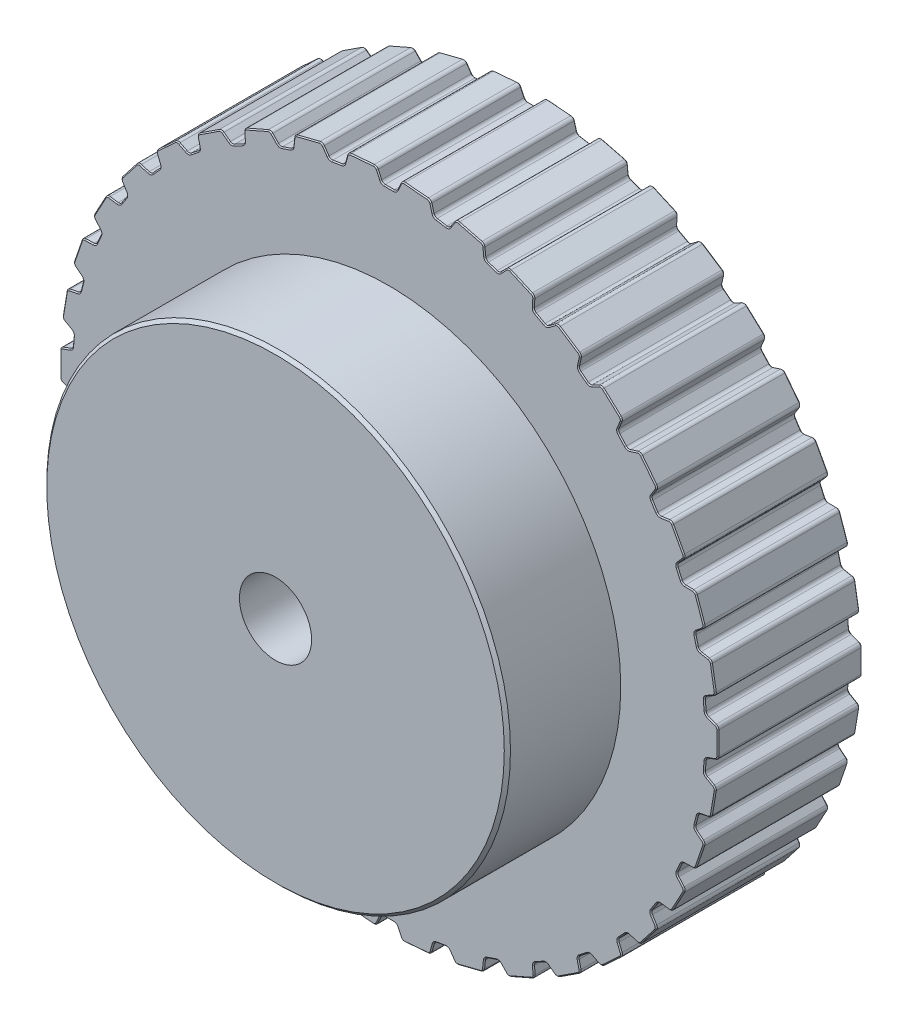
from build123d import *

# Parameters (mm, degrees)
SKETCH1_R           = 32
BOSS_EXTRUDE1_DEPTH = 14
SKETCH2_R           = 22.5
SKETCH2_R_2         = 3.5
BOSS_EXTRUDE2_DEPTH = 11
SKETCH2_2_R         = 3.5
CUT_EXTRUDE1_DEPTH  = 48.370877129
SKETCH3_OUTSIDE_W   = 84.78
SKETCH3_OUTSIDE_H   = 84.78
CUT_EXTRUDE2_DEPTH  = 48.370877129
CHAMFER1_SIZE       = 0.1
CHAMFER2_SIZE       = 0.3


with BuildPart() as part:
    # Sketch1 → Boss-Extrude1 (new body)
    with BuildSketch(Plane.XY):
        Circle(SKETCH1_R)
    extrude(amount=BOSS_EXTRUDE1_DEPTH)

    # Sketch2 → Boss-Extrude2 (add)
    with BuildSketch(Plane.XY.offset(14)):
        Circle(SKETCH2_R)
        Circle(SKETCH2_R_2, mode=Mode.SUBTRACT)
    extrude(amount=BOSS_EXTRUDE2_DEPTH)

    # Sketch2<2> → Cut-Extrude1 (cut, through all)
    with BuildSketch(Plane.XY.offset(14)):
        Circle(SKETCH2_2_R)
    extrude(amount=-CUT_EXTRUDE1_DEPTH, mode=Mode.SUBTRACT)

    # Sketch3 outside → Cut-Extrude2 (cut, through all)
    with BuildSketch(Plane.XY.offset(14)):
        Rectangle(SKETCH3_OUTSIDE_W, SKETCH3_OUTSIDE_H)
        with BuildLine():
            Line((0.450702575, 30.73), (-0.450702575, 30.73))
            ThreePointArc((-0.450702575, 30.73), (-0.654876426, 30.789511251), (-0.795099534, 30.949405061))
            Line((-0.795099534, 30.949405061), (-1.127200423, 31.661597716))
            ThreePointArc((-1.127200423, 31.661597716), (-1.280803372, 31.829709395), (-1.502939845, 31.879817176))
            Line((-1.502939845, 31.879817176), (-3.74156592, 31.694835267))
            ThreePointArc((-3.74156592, 31.694835267), (-3.952464615, 31.608944972), (-4.07638982, 31.417900616))
            Line((-4.07638982, 31.417900616), (-4.286167994, 30.663258392))
            ThreePointArc((-4.286167994, 30.663258392), (-4.398188573, 30.482482452), (-4.589796613, 30.390206185))
            Line((-4.589796613, 30.390206185), (-5.536262381, 30.232417433))
            ThreePointArc((-5.536262381, 30.232417433), (-5.747442965, 30.257543343), (-5.912050721, 30.392201566))
            Line((-5.912050721, 30.392201566), (-6.355297393, 31.037975642))
            ThreePointArc((-6.355297393, 31.037975642), (-6.534497114, 31.178484938), (-6.761853365, 31.191312157))
            Line((-6.761853365, 31.191312157), (-8.939416379, 30.640055112))
            ThreePointArc((-8.939416379, 30.640055112), (-9.133283385, 30.520593878), (-9.224041675, 30.311743847))
            Line((-9.224041675, 30.311743847), (-9.306899845, 29.530306772))
            ThreePointArc((-9.306899845, 29.530306772), (-9.387607843, 29.333546081), (-9.56139572, 29.210964173))
            Line((-9.56139572, 29.210964173), (-10.413960253, 28.918278399))
            ThreePointArc((-10.413960253, 28.918278399), (-10.626394673, 28.908270025), (-10.810937541, 29.013969979))
            Line((-10.810937541, 29.013969979), (-11.356292865, 29.579741089))
            ThreePointArc((-11.356292865, 29.579741089), (-11.556158955, 29.688869218), (-11.782529432, 29.664134426))
            Line((-11.782529432, 29.664134426), (-13.839797043, 28.762294649))
            ThreePointArc((-13.839797043, 28.762294649), (-14.011380132, 28.612579432), (-14.066558727, 28.391647938))
            Line((-14.066558727, 28.391647938), (-14.019938611, 27.60977945))
            ThreePointArc((-14.019938611, 27.60977945), (-14.067191755, 27.402425427), (-14.218455888, 27.252933913))
            Line((-14.218455888, 27.252933913), (-15.062405605, 26.796377658))
            ThreePointArc((-15.062405605, 26.796377658), (-15.270302212, 26.751571954), (-15.46971452, 26.825485971))
            Line((-15.46971452, 26.825485971), (-16.098627364, 27.292348268))
            ThreePointArc((-16.098627364, 27.292348268), (-16.313740844, 27.367058329), (-16.532943297, 27.305368079))
            Line((-16.532943297, 27.305368079), (-18.413527071, 26.076926107))
            ThreePointArc((-18.413527071, 26.076926107), (-18.558100828, 25.900989098), (-18.57612809, 25.67398597))
            Line((-18.57612809, 25.67398597), (-18.400764572, 24.907985307))
            ThreePointArc((-18.400764572, 24.907985307), (-18.413211496, 24.695679809), (-18.537780786, 24.523310895))
            Line((-18.537780786, 24.523310895), (-19.249116105, 23.969656393))
            ThreePointArc((-19.249116105, 23.969656393), (-19.446790529, 23.891212956), (-19.655655074, 23.931264823))
            Line((-19.655655074, 23.931264823), (-20.355167122, 24.28930431))
            ThreePointArc((-20.355167122, 24.28930431), (-20.579637762, 24.327623163), (-20.785711487, 24.230726196))
            Line((-20.785711487, 24.230726196), (-22.438683768, 22.709756885))
            ThreePointArc((-22.438683768, 22.709756885), (-22.55235756, 22.512440714), (-22.532810088, 22.285563437))
            Line((-22.532810088, 22.285563437), (-22.234843695, 21.561196266))
            ThreePointArc((-22.234843695, 21.561196266), (-22.212208793, 21.349734185), (-22.306737202, 21.159227151))
            Line((-22.306737202, 21.159227151), (-22.956715823, 20.453378348))
            ThreePointArc((-22.956715823, 20.453378348), (-23.13879963, 20.343496422), (-23.351407071, 20.348656504))
            Line((-23.351407071, 20.348656504), (-24.097833622, 20.586015247))
            ThreePointArc((-24.097833622, 20.586015247), (-24.325549977, 20.586830078), (-24.512844646, 20.457307456))
            Line((-24.512844646, 20.457307456), (-25.892658747, 18.684801305))
            ThreePointArc((-25.892658747, 18.684801305), (-25.972272446, 18.471454026), (-25.915615145, 18.250897111))
            Line((-25.915615145, 18.250897111), (-25.501033298, 17.583340918))
            ThreePointArc((-25.501033298, 17.583340918), (-25.443870331, 17.378497208), (-25.505722019, 17.175020135))
            Line((-25.505722019, 17.175020135), (-25.998743905, 16.42039396))
            ThreePointArc((-25.998743905, 16.42039396), (-26.160237241, 16.282016025), (-26.370789749, 16.252079565))
            Line((-26.370789749, 16.252079565), (-27.148655536, 16.363588294))
            ThreePointArc((-27.148655536, 16.363588294), (-27.373405849, 16.326945428), (-27.536851537, 16.168386577))
            Line((-27.536851537, 16.168386577), (-28.606403293, 14.193108356))
            ThreePointArc((-28.606403293, 14.193108356), (-28.649849469, 13.969573499), (-28.557694202, 13.761336113))
            Line((-28.557694202, 13.761336113), (-28.040670814, 13.172966683))
            ThreePointArc((-28.040670814, 13.172966683), (-27.950600707, 12.980311742), (-27.978149774, 12.76943358))
            Line((-27.978149774, 12.76943358), (-28.363722028, 11.890781899))
            ThreePointArc((-28.363722028, 11.890781899), (-28.50026143, 11.727731163), (-28.703024689, 11.663578134))
            Line((-28.703024689, 11.663578134), (-29.486078048, 11.645711821))
            ThreePointArc((-29.486078048, 11.645711821), (-29.701720679, 11.572543122), (-29.836811279, 11.389223914))
            Line((-29.836811279, 11.389223914), (-30.56633144, 9.264732129))
            ThreePointArc((-30.56633144, 9.264732129), (-30.572357701, 9.037094069), (-30.447155536, 8.846884131))
            Line((-30.447155536, 8.846884131), (-29.838281735, 8.35011248))
            ThreePointArc((-29.838281735, 8.35011248), (-29.717703371, 8.174928552), (-29.710134866, 7.962393218))
            Line((-29.710134866, 7.962393218), (-29.931416749, 7.088570826))
            ThreePointArc((-29.931416749, 7.088570826), (-30.039228688, 6.905253788), (-30.228652528, 6.80857308))
            Line((-30.228652528, 6.80857308), (-31.000578226, 6.661467351))
            ThreePointArc((-31.000578226, 6.661467351), (-31.201253027, 6.553833589), (-31.304358803, 6.350795166))
            Line((-31.304358803, 6.350795166), (-31.674587505, 4.13526008))
            ThreePointArc((-31.674587505, 4.13526008), (-31.643097998, 3.909730008), (-31.488321388, 3.742698264))
            Line((-31.488321388, 3.742698264), (-30.808268512, 3.354085532))
            ThreePointArc((-30.808268512, 3.354085532), (-30.660523695, 3.201114883), (-30.61810805, 2.992717514))
            Line((-30.61810805, 2.992717514), (-30.697491202, 2.036478498))
            ThreePointArc((-30.697491202, 2.036478498), (-30.773690034, 1.83792803), (-30.944636567, 1.711413867))
            Line((-30.944636567, 1.711413867), (-31.679460753, 1.44025859))
            ThreePointArc((-31.679460753, 1.44025859), (-31.859661433, 1.301035325), (-31.927908802, 1.083785011))
            Line((-31.927908802, 1.083785011), (-31.928080194, -1.162470758))
            ThreePointArc((-31.928080194, -1.162470758), (-31.859865978, -1.379731484), (-31.679686546, -1.518982246))
            Line((-31.679686546, -1.518982246), (-30.942501715, -1.791136439))
            ThreePointArc((-30.942501715, -1.791136439), (-30.771574491, -1.917676688), (-30.695405959, -2.116238782))
            Line((-30.695405959, -2.116238782), (-30.620968511, -3.014565176))
            ThreePointArc((-30.620968511, -3.014565176), (-30.663415958, -3.22295607), (-30.811184117, -3.375904171))
            Line((-30.811184117, -3.375904171), (-31.493519599, -3.765683171))
            ThreePointArc((-31.493519599, -3.765683171), (-31.648372661, -3.93264404), (-31.679965413, -4.158159672))
            Line((-31.679965413, -4.158159672), (-31.310751036, -6.373864019))
            ThreePointArc((-31.310751036, -6.373864019), (-31.207738223, -6.576949624), (-31.007112718, -6.684675244))
            Line((-31.007112718, -6.684675244), (-30.237724636, -6.831419058))
            ThreePointArc((-30.237724636, -6.831419058), (-30.048315552, -6.928128672), (-29.940531588, -7.111462159))
            Line((-29.940531588, -7.111462159), (-29.705123241, -8.041665174))
            ThreePointArc((-29.705123241, -8.041665174), (-29.712724179, -8.254199351), (-29.833329275, -8.429364876))
            Line((-29.833329275, -8.429364876), (-30.440294685, -8.924425236))
            ThreePointArc((-30.440294685, -8.924425236), (-30.565525875, -9.114616065), (-30.559534352, -9.342255043))
            Line((-30.559534352, -9.342255043), (-29.830338401, -11.466858129))
            ThreePointArc((-29.830338401, -11.466858129), (-29.695275777, -11.65019795), (-29.479644315, -11.723399556))
            Line((-29.479644315, -11.723399556), (-28.69403387, -11.741444161))
            ThreePointArc((-28.69403387, -11.741444161), (-28.491280403, -11.805628131), (-28.354765885, -11.9686997))
            Line((-28.354765885, -11.9686997), (-27.992675561, -12.794182493))
            ThreePointArc((-27.992675561, -12.794182493), (-27.965158675, -13.005064857), (-28.05525818, -13.197706051))
            Line((-28.05525818, -13.197706051), (-28.574061809, -13.787919719))
            ThreePointArc((-28.574061809, -13.787919719), (-28.6663124, -13.996114894), (-28.622968564, -14.219669617))
            Line((-28.622968564, -14.219669617), (-27.554321214, -16.195437278))
            ThreePointArc((-27.554321214, -16.195437278), (-27.390948132, -16.354070939), (-27.166214618, -16.390816693))
            Line((-27.166214618, -16.390816693), (-26.390866466, -16.279789621))
            ThreePointArc((-26.390866466, -16.279789621), (-26.180318528, -16.309758212), (-26.018846311, -16.448160789))
            Line((-26.018846311, -16.448160789), (-25.494156612, -17.251525874))
            ThreePointArc((-25.494156612, -17.251525874), (-25.432335976, -17.455012383), (-25.489530202, -17.659847368))
            Line((-25.489530202, -17.659847368), (-25.902862716, -18.325165338))
            ThreePointArc((-25.902862716, -18.325165338), (-25.959553673, -18.545713605), (-25.879972532, -18.75907303))
            Line((-25.879972532, -18.75907303), (-24.500428935, -20.531789723))
            ThreePointArc((-24.500428935, -20.531789723), (-24.313154034, -20.661340925), (-24.085437557, -20.660560844))
            Line((-24.085437557, -20.660560844), (-23.336534579, -20.422540448))
            ThreePointArc((-23.336534579, -20.422540448), (-23.123926353, -20.41741281), (-22.941859316, -20.527322521))
            Line((-22.941859316, -20.527322521), (-22.331354219, -21.190507843))
            ThreePointArc((-22.331354219, -21.190507843), (-22.236854883, -21.381029301), (-22.259522055, -21.592487925))
            Line((-22.259522055, -21.592487925), (-22.558573408, -22.319177451))
            ThreePointArc((-22.558573408, -22.319177451), (-22.578224744, -22.546045755), (-22.464641297, -22.743413946))
            Line((-22.464641297, -22.743413946), (-20.812365498, -24.265139839))
            ThreePointArc((-20.812365498, -24.265139839), (-20.606336154, -24.362131137), (-20.381847995, -24.323915052))
            Line((-20.381847995, -24.323915052), (-19.684560775, -23.967148599))
            ThreePointArc((-19.684560775, -23.967148599), (-19.47569012, -23.927128606), (-19.27802767, -24.005602207))
            Line((-19.27802767, -24.005602207), (-18.520914889, -24.595072288))
            ThreePointArc((-18.520914889, -24.595072288), (-18.396371904, -24.76746021), (-18.383957379, -24.979767605))
            Line((-18.383957379, -24.979767605), (-18.558866005, -25.74324566))
            ThreePointArc((-18.558866005, -25.74324566), (-18.540873385, -25.970251537), (-18.396326477, -26.146210606))
            Line((-18.396326477, -26.146210606), (-16.515930189, -27.374939545))
            ThreePointArc((-16.515930189, -27.374939545), (-16.296737152, -27.436663244), (-16.081612273, -27.361986011))
            Line((-16.081612273, -27.361986011), (-15.450572021, -26.893693817))
            ThreePointArc((-15.450572021, -26.893693817), (-15.251148436, -26.819810231), (-15.043258669, -26.86464766))
            Line((-15.043258669, -26.86464766), (-14.2504965, -27.293669092))
            ThreePointArc((-14.2504965, -27.293669092), (-14.099255182, -27.443183687), (-14.052033681, -27.650544918))
            Line((-14.052033681, -27.650544918), (-14.098925904, -28.434962217))
            ThreePointArc((-14.098925904, -28.434962217), (-14.043848458, -28.655918949), (-13.872333928, -28.805712702))
            Line((-13.872333928, -28.805712702), (-11.8154794, -29.708494213))
            ThreePointArc((-11.8154794, -29.708494213), (-11.589120271, -29.733332637), (-11.389204243, -29.624296019))
            Line((-11.389204243, -29.624296019), (-10.845539846, -29.060451366))
            ThreePointArc((-10.845539846, -29.060451366), (-10.66098085, -28.954779575), (-10.448547959, -28.964820368))
            Line((-10.448547959, -28.964820368), (-9.541057015, -29.276517216))
            ThreePointArc((-9.541057015, -29.276517216), (-9.367287846, -29.399125643), (-9.286609875, -29.595898648))
            Line((-9.286609875, -29.595898648), (-9.20414055, -30.374802095))
            ThreePointArc((-9.20414055, -30.374802095), (-9.113414132, -30.583665973), (-8.919565358, -30.70315679))
            Line((-8.919565358, -30.70315679), (-6.742086493, -31.254746129))
            ThreePointArc((-6.742086493, -31.254746129), (-6.514728287, -31.241953605), (-6.335507126, -31.101471657))
            Line((-6.335507126, -31.101471657), (-5.890712601, -30.453654391))
            ThreePointArc((-5.890712601, -30.453654391), (-5.726084298, -30.319021289), (-5.514899882, -30.293927606))
            Line((-5.514899882, -30.293927606), (-4.625788723, -30.442294017))
            ThreePointArc((-4.625788723, -30.442294017), (-4.434194767, -30.534599523), (-4.322201776, -30.715392555))
            Line((-4.322201776, -30.715392555), (-4.111853368, -31.472533841))
            ThreePointArc((-4.111853368, -31.472533841), (-3.988015637, -31.66363491), (-3.777156285, -31.749621747))
            Line((-3.777156285, -31.749621747), (-1.538615131, -31.935628493))
            ThreePointArc((-1.538615131, -31.935628493), (-1.316455741, -31.885622413), (-1.162775847, -31.717581072))
            Line((-1.162775847, -31.717581072), (-0.831648746, -31.007759536))
            ThreePointArc((-0.831648746, -31.007759536), (-0.691401239, -30.847887127), (-0.487218309, -30.788407034))
            Line((-0.487218309, -30.788407034), (0.472310074, -30.78855346))
            ThreePointArc((0.472310074, -30.78855346), (0.676474842, -30.848095867), (0.816673548, -31.008011074))
            Line((0.816673548, -31.008011074), (1.147583993, -31.717933637))
            ThreePointArc((1.147583993, -31.717933637), (1.301212593, -31.886021874), (1.523356711, -31.936095756))
            Line((1.523356711, -31.936095756), (3.761954531, -31.750772231))
            ThreePointArc((3.761954531, -31.750772231), (3.972840116, -31.664849753), (4.096736166, -31.473786488))
            Line((4.096736166, -31.473786488), (4.307084574, -30.716645202))
            ThreePointArc((4.307084574, -30.716645202), (4.419077565, -30.53585217), (4.610671522, -30.443546664))
            Line((4.610671522, -30.443546664), (5.49978268, -30.295180253))
            ThreePointArc((5.49978268, -30.295180253), (5.710967096, -30.320273936), (5.8755954, -30.454907038))
            Line((5.8755954, -30.454907038), (6.320389924, -31.102724304))
            ThreePointArc((6.320389924, -31.102724304), (6.499568201, -31.243260945), (6.726922492, -31.256122858))
            Line((6.726922492, -31.256122858), (8.904569604, -30.705198121))
            ThreePointArc((8.904569604, -30.705198121), (9.098454837, -30.585766472), (9.189244997, -30.376930294))
            Line((9.189244997, -30.376930294), (9.271952042, -29.598052054))
            ThreePointArc((9.271952042, -29.598052054), (9.352690065, -29.401303681), (9.526496647, -29.278748295))
            Line((9.526496647, -29.278748295), (10.43408268, -28.96732843))
            ThreePointArc((10.43408268, -28.96732843), (10.646518625, -28.957352474), (10.831045361, -29.063080588))
            Line((10.831045361, -29.063080588), (11.374537645, -29.627091143))
            ThreePointArc((11.374537645, -29.627091143), (11.574420386, -29.736188771), (11.800787085, -29.711419434))
            Line((11.800787085, -29.711419434), (13.85791705, -28.809265725))
            ThreePointArc((13.85791705, -28.809265725), (14.02947729, -28.659524326), (14.08462217, -28.438584414))
            Line((14.08462217, -28.438584414), (14.037729947, -27.654167116))
            ThreePointArc((14.037729947, -27.654167116), (14.084951448, -27.446805884), (14.236192766, -27.297291289))
            Line((14.236192766, -27.297291289), (15.028954935, -26.868269858))
            ThreePointArc((15.028954935, -26.868269858), (15.236844702, -26.823432428), (15.436268287, -26.897316015))
            Line((15.436268287, -26.897316015), (16.067308539, -27.365608208))
            ThreePointArc((16.067308539, -27.365608208), (16.282410616, -27.440351095), (16.501622481, -27.378694297))
            Line((16.501622481, -27.378694297), (18.382393695, -26.15053932))
            ThreePointArc((18.382393695, -26.15053932), (18.526994299, -25.974624375), (18.545056201, -25.747624001))
            Line((18.545056201, -25.747624001), (18.3703806, -24.984092598))
            ThreePointArc((18.3703806, -24.984092598), (18.382859922, -24.771789002), (18.507455515, -24.5994391))
            Line((18.507455515, -24.5994391), (19.264748168, -24.010200119))
            ThreePointArc((19.264748168, -24.010200119), (19.46243456, -23.931786849), (19.671292991, -23.971870589))
            Line((19.671292991, -23.971870589), (20.368471292, -24.32884984))
            ThreePointArc((20.368471292, -24.32884984), (20.592947776, -24.367134438), (20.799006713, -24.270206025))
            Line((20.799006713, -24.270206025), (22.451746872, -22.748984485))
            ThreePointArc((22.451746872, -22.748984485), (22.565390552, -22.551650969), (22.545808458, -22.324776677))
            Line((22.545808458, -22.324776677), (22.246757104, -21.598087152))
            ThreePointArc((22.246757104, -21.598087152), (22.224089932, -21.386628527), (22.318589269, -21.19610707))
            Line((22.318589269, -21.19610707), (22.929094366, -20.532921748))
            ThreePointArc((22.929094366, -20.532921748), (23.111161402, -20.423012037), (23.323769628, -20.428139674))
            Line((23.323769628, -20.428139674), (24.072672606, -20.66616007))
            ThreePointArc((24.072672606, -20.66616007), (24.300388835, -20.667009651), (24.487703267, -20.537515612))
            Line((24.487703267, -20.537515612), (25.86778784, -18.765220045))
            ThreePointArc((25.86778784, -18.765220045), (25.947434095, -18.551884917), (25.890810452, -18.331319359))
            Line((25.890810452, -18.331319359), (25.477681015, -17.665875269))
            ThreePointArc((25.477681015, -17.665875269), (25.420549308, -17.461022838), (25.482432046, -17.257555206))
            Line((25.482432046, -17.257555206), (26.007366911, -16.454350296))
            ThreePointArc((26.007366911, -16.454350296), (26.168881362, -16.315997007), (26.379438436, -16.286092677))
            Line((26.379438436, -16.286092677), (27.154752667, -16.397356384))
            ThreePointArc((27.154752667, -16.397356384), (27.379497385, -16.360679221), (27.542918876, -16.20209543))
            Line((27.542918876, -16.20209543), (28.612169187, -14.226654016))
            ThreePointArc((28.612169187, -14.226654016), (28.655581251, -14.003112532), (28.563394207, -13.794889211))
            Line((28.563394207, -13.794889211), (28.044590578, -13.204675544))
            ThreePointArc((28.044590578, -13.204675544), (27.954491072, -13.01203435), (27.982007958, -12.801151986))
            Line((27.982007958, -12.801151986), (28.344098283, -11.975669193))
            ThreePointArc((28.344098283, -11.975669193), (28.480612801, -11.812597623), (28.683366268, -11.748413653))
            Line((28.683366268, -11.748413653), (29.468976713, -11.730369048))
            ThreePointArc((29.468976713, -11.730369048), (29.684630506, -11.657233258), (29.81974908, -11.473934666))
            Line((29.81974908, -11.473934666), (30.549593434, -9.349554233))
            ThreePointArc((30.549593434, -9.349554233), (30.555654433, -9.121917094), (30.430481296, -8.931688053))
            Line((30.430481296, -8.931688053), (29.823667008, -8.436442468))
            ThreePointArc((29.823667008, -8.436442468), (29.703115379, -8.261240142), (29.695579308, -8.048703655))
            Line((29.695579308, -8.048703655), (29.931271546, -7.118572531))
            ThreePointArc((29.931271546, -7.118572531), (30.039111458, -6.935271948), (30.22855005, -6.838620147))
            Line((30.22855005, -6.838620147), (30.997982883, -6.69211116))
            ThreePointArc((30.997982883, -6.69211116), (31.198641257, -6.584446777), (31.301716048, -6.381392621))
            Line((31.301716048, -6.381392621), (31.67160665, -4.165801064))
            ThreePointArc((31.67160665, -4.165801064), (31.640082727, -3.9402758), (31.48528063, -3.773267677))
            Line((31.48528063, -3.773267677), (30.802945147, -3.383488677))
            ThreePointArc((30.802945147, -3.383488677), (30.655176988, -3.230540576), (30.612729542, -3.022149682))
            Line((30.612729542, -3.022149682), (30.687166989, -2.123823287))
            ThreePointArc((30.687166989, -2.123823287), (30.763335522, -1.925261194), (30.934262746, -1.798720945))
            Line((30.934262746, -1.798720945), (31.671447576, -1.526566752))
            ThreePointArc((31.671447576, -1.526566752), (31.8516695, -1.387370988), (31.919950021, -1.170131091))
            Line((31.919950021, -1.170131091), (31.920464196, 1.076124625))
            ThreePointArc((31.920464196, 1.076124625), (31.852283135, 1.293395759), (31.672124955, 1.432674015))
            Line((31.672124955, 1.432674015), (30.937383561, 1.704053551))
            ThreePointArc((30.937383561, 1.704053551), (30.766475649, 1.830619882), (30.690337419, 2.029193597))
            Line((30.690337419, 2.029193597), (30.611246119, 2.985456796))
            ThreePointArc((30.611246119, 2.985456796), (30.653725365, 3.19384121), (30.801516863, 3.34676676))
            Line((30.801516863, 3.34676676), (31.481688313, 3.735171919))
            ThreePointArc((31.481688313, 3.735171919), (31.636515895, 3.902156416), (31.668074232, 4.127676867))
            Line((31.668074232, 4.127676867), (31.298521738, 6.343324845))
            ThreePointArc((31.298521738, 6.343324845), (31.195477935, 6.546394727), (30.994835994, 6.65408973))
            Line((30.994835994, 6.65408973), (30.222910295, 6.80119546))
            ThreePointArc((30.222910295, 6.80119546), (30.033486456, 6.897876168), (29.925674516, 7.081193205))
            Line((29.925674516, 7.081193205), (29.704392634, 7.955015598))
            ThreePointArc((29.704392634, 7.955015598), (29.711961139, 8.167550932), (29.832539503, 8.34273486))
            Line((29.832539503, 8.34273486), (30.441413304, 8.839506511))
            ThreePointArc((30.441413304, 8.839506511), (30.566673516, 9.029678227), (30.560716731, 9.257318117))
            Line((30.560716731, 9.257318117), (29.831845007, 11.382032455))
            ThreePointArc((29.831845007, 11.382032455), (29.696810363, 11.565392885), (29.481190074, 11.638627395))
            Line((29.481190074, 11.638627395), (28.698142204, 11.656732699))
            ThreePointArc((28.698142204, 11.656732699), (28.495398534, 11.720947609), (28.358908903, 11.884040009))
            Line((28.358908903, 11.884040009), (27.973604834, 12.762809327))
            ThreePointArc((27.973604834, 12.762809327), (27.94612013, 12.973695888), (28.036249032, 13.16632333))
            Line((28.036249032, 13.16632333), (28.553451967, 13.754534935))
            ThreePointArc((28.553451967, 13.754534935), (28.645670786, 13.962744185), (28.602292835, 14.186292292))
            Line((28.602292835, 14.186292292), (27.533343992, 16.161896852))
            ThreePointArc((27.533343992, 16.161896852), (27.369946704, 16.32050558), (27.145207585, 16.357217039))
            Line((27.145207585, 16.357217039), (26.367341799, 16.24570831))
            ThreePointArc((26.367341799, 16.24570831), (26.15678929, 16.27564477), (25.995295954, 16.414022705))
            Line((25.995295954, 16.414022705), (25.502274068, 17.16864888))
            ThreePointArc((25.502274068, 17.16864888), (25.44042238, 17.372125953), (25.497585347, 17.576969663))
            Line((25.497585347, 17.576969663), (25.912167195, 18.244525856))
            ThreePointArc((25.912167195, 18.244525856), (25.968891808, 18.465065469), (25.889343227, 18.678437036))
            Line((25.889343227, 18.678437036), (24.510070166, 20.451364229))
            ThreePointArc((24.510070166, 20.451364229), (24.322815037, 20.580944008), (24.095098443, 20.580198677))
            Line((24.095098443, 20.580198677), (23.348599484, 20.343067758))
            ThreePointArc((23.348599484, 20.343067758), (23.135990478, 20.337972565), (22.953940216, 20.447910058))
            Line((22.953940216, 20.447910058), (22.304177053, 21.153957204))
            ThreePointArc((22.304177053, 21.153957204), (22.209706792, 21.34449308), (22.232406233, 21.555948243))
            Line((22.232406233, 21.555948243), (22.530593691, 22.280224439))
            ThreePointArc((22.530593691, 22.280224439), (22.550210406, 22.50709574), (22.436596841, 22.704446595))
            Line((22.436596841, 22.704446595), (20.784088843, 24.22592033))
            ThreePointArc((20.784088843, 24.22592033), (20.5780447, 24.322880186), (20.353562376, 24.284629845))
            Line((20.353562376, 24.284629845), (19.654050328, 23.926590358))
            ThreePointArc((19.654050328, 23.926590358), (19.445185783, 23.886538491), (19.247511359, 23.964981927))
            Line((19.247511359, 23.964981927), (18.53617604, 24.518636429))
            ThreePointArc((18.53617604, 24.518636429), (18.41160675, 24.691005343), (18.399159826, 24.903310841))
            Line((18.399159826, 24.903310841), (18.574523344, 25.669311504))
            ThreePointArc((18.574523344, 25.669311504), (18.556565365, 25.896320124), (18.412045311, 26.072301249))
            Line((18.412045311, 26.072301249), (16.531836551, 27.301317126))
            ThreePointArc((16.531836551, 27.301317126), (16.312652936, 27.363074274), (16.097516664, 27.28842987))
            Line((16.097516664, 27.28842987), (15.468461361, 26.821759542))
            ThreePointArc((15.468461361, 26.821759542), (15.269026504, 26.747906389), (15.061143581, 26.792775542))
            Line((15.061143581, 26.792775542), (14.217333246, 27.249589353))
            ThreePointArc((14.217333246, 27.249589353), (14.066114745, 27.399127026), (14.018924889, 27.606495461))
            Line((14.018924889, 27.606495461), (14.065783632, 28.388349684))
            ThreePointArc((14.065783632, 28.388349684), (14.010672469, 28.609298009), (13.839135082, 28.759065587))
            Line((13.839135082, 28.759065587), (11.782142811, 29.661533208))
            ThreePointArc((11.782142811, 29.661533208), (11.555779894, 29.686337088), (11.355880508, 29.577269964))
            Line((11.355880508, 29.577269964), (10.810525183, 29.011498853))
            ThreePointArc((10.810525183, 29.011498853), (10.625982315, 28.9057989), (10.413547895, 28.915807274))
            Line((10.413547895, 28.915807274), (9.560983362, 29.208493048))
            ThreePointArc((9.560983362, 29.208493048), (9.387195485, 29.331074956), (9.306487487, 29.527835647))
            Line((9.306487487, 29.527835647), (9.223629317, 30.309272722))
            ThreePointArc((9.223629317, 30.309272722), (9.132934773, 30.518150443), (8.939104236, 30.63767084))
            Line((8.939104236, 30.63767084), (6.76170957, 31.18959246))
            ThreePointArc((6.76170957, 31.18959246), (6.534349414, 31.176834632), (6.355106817, 31.036380035))
            Line((6.355106817, 31.036380035), (5.911663074, 30.39074127))
            ThreePointArc((5.911663074, 30.39074127), (5.747014227, 30.256133292), (5.535825984, 30.231071836))
            Line((5.535825984, 30.231071836), (4.589408418, 30.389149446))
            ThreePointArc((4.589408418, 30.389149446), (4.39782855, 30.481484189), (4.28586315, 30.662294309))
            Line((4.28586315, 30.662294309), (4.076315305, 31.417000523))
            ThreePointArc((4.076315305, 31.417000523), (3.952448413, 31.608082692), (3.741575942, 31.694037351))
            Line((3.741575942, 31.694037351), (1.503006429, 31.879702488))
            ThreePointArc((1.503006429, 31.879702488), (1.280854673, 31.829662507), (1.127200423, 31.661597716))
            Line((1.127200423, 31.661597716), (0.795099534, 30.949405061))
            ThreePointArc((0.795099534, 30.949405061), (0.654876426, 30.789511251), (0.450702575, 30.73))
        make_face(mode=Mode.SUBTRACT)
    extrude(amount=-CUT_EXTRUDE2_DEPTH, mode=Mode.SUBTRACT)

    # Chamfer1
    chamfer1_edges = [part.edges().sort_by_distance(p)[0] for p in [
        (0.961149979, 31.305501388, 0),
        (0.654876426, 30.789511251, 0),
        (0, 30.73, 0),
        (-0.654876426, 30.789511251, 0),
        (-0.961149979, 31.305501388, 0),
        (-1.280803372, 31.829709395, 0),
        (-2.622252882, 31.787326222, 0),
        (-3.952464615, 31.608944972, 0),
        (-4.181278907, 31.040579504, 0),
        (-4.398188573, 30.482482452, 0),
        (-5.063029497, 30.311311809, 0),
        (-5.747442965, 30.257543343, 0),
        (-6.133674057, 30.715088604, 0),
        (-6.534497114, 31.178484938, 0),
        (-7.850634872, 30.915683634, 0),
        (-9.133283385, 30.520593878, 0),
        (-9.26547076, 29.92102531, 0),
        (-9.387607843, 29.333546081, 0),
        (-9.987677986, 29.064621286, 0),
        (-10.626394673, 28.908270025, 0),
        (-11.083615203, 29.296855534, 0),
        (-11.556158955, 29.688869218, 0),
        (-12.811163237, 29.213214537, 0),
        (-14.011380132, 28.612579432, 0),
        (-14.043248669, 28.000713694, 0),
        (-14.067191755, 27.402425427, 0),
        (-14.640430746, 27.024655786, 0),
        (-15.270302212, 26.751571954, 0),
        (-15.784170942, 27.05891712, 0),
        (-16.313740844, 27.367058329, 0),
        (-17.473235184, 26.691147093, 0),
        (-18.558100828, 25.900989098, 0),
        (-18.488446331, 25.290985638, 0),
        (-18.413211496, 24.695679809, 0),
        (-18.893448446, 24.246483644, 0),
        (-19.446790529, 23.891212956, 0),
        (-20.005411098, 24.110284567, 0),
        (-20.579637762, 24.327623163, 0),
        (-21.612197628, 23.470241541, 0),
        (-22.55235756, 22.512440714, 0),
        (-22.383826892, 21.923379851, 0),
        (-22.212208793, 21.349734185, 0),
        (-22.631726512, 20.806302749, 0),
        (-23.13879963, 20.343496422, 0),
        (-23.724620346, 20.467335875, 0),
        (-24.325549977, 20.586830078, 0),
        (-25.202751697, 19.57105438, 0),
        (-25.972272446, 18.471454026, 0),
        (-25.708324222, 17.917119015, 0),
        (-25.443870331, 17.378497208, 0),
        (-25.752232962, 16.797707048, 0),
        (-26.160237241, 16.282016025, 0),
        (-26.759722643, 16.307833929, 0),
        (-27.373405849, 16.326945428, 0),
        (-28.071627415, 15.180747467, 0),
        (-28.649849469, 13.969573499, 0),
        (-28.299182508, 13.467151398, 0),
        (-27.950600707, 12.980311742, 0),
        (-28.170935901, 12.330107739, 0),
        (-28.50026143, 11.727731163, 0),
        (-29.094551369, 11.654644978, 0),
        (-29.701720679, 11.572543122, 0),
        (-30.201571359, 10.326978022, 0),
        (-30.572357701, 9.037094069, 0),
        (-30.142718635, 8.598498306, 0),
        (-29.717703371, 8.174928552, 0),
        (-29.820775807, 7.525482022, 0),
        (-30.039228688, 6.905253788, 0),
        (-30.614615377, 6.735020215, 0),
        (-31.201253027, 6.553833589, 0),
        (-31.489473154, 5.243027623, 0),
        (-31.643097998, 3.909730008, 0),
        (-31.14829495, 3.548391898, 0),
        (-30.660523695, 3.201114883, 0),
        (-30.657799626, 2.514598006, 0),
        (-30.773690034, 1.83792803, 0),
        (-31.31204866, 1.575836228, 0),
        (-31.859661433, 1.301035325, 0),
        (-31.927994498, -0.039342874, 0),
        (-31.859865978, -1.379731484, 0),
        (-31.31109413, -1.655059343, 0),
        (-30.771574491, -1.917676688, 0),
        (-30.658187235, -2.565401979, 0),
        (-30.663415958, -3.22295607, 0),
        (-31.152351858, -3.570793671, 0),
        (-31.648372661, -3.93264404, 0),
        (-31.495358225, -5.266011846, 0),
        (-31.207738223, -6.576949624, 0),
        (-30.622418677, -6.758047151, 0),
        (-30.048315552, -6.928128672, 0),
        (-29.822827414, -7.576563667, 0),
        (-29.712724179, -8.254199351, 0),
        (-30.13681198, -8.676895056, 0),
        (-30.565525875, -9.114616065, 0),
        (-30.194936376, -10.404556586, 0),
        (-29.695275777, -11.65019795, 0),
        (-29.086839092, -11.732421858, 0),
        (-28.491280403, -11.805628131, 0),
        (-28.173720723, -12.381441097, 0),
        (-27.965158675, -13.005064857, 0),
        (-28.314659995, -13.492812885, 0),
        (-28.6663124, -13.996114894, 0),
        (-28.088644889, -15.207553448, 0),
        (-27.390948132, -16.354070939, 0),
        (-26.778540542, -16.335303157, 0),
        (-26.180318528, -16.309758212, 0),
        (-25.756501461, -16.849843332, 0),
        (-25.432335976, -17.455012383, 0),
        (-25.696196459, -17.992506353, 0),
        (-25.959553673, -18.545713605, 0),
        (-25.190200734, -19.645431377, 0),
        (-24.313154034, -20.661340925, 0),
        (-23.710986068, -20.541550646, 0),
        (-23.123926353, -20.41741281, 0),
        (-22.636606768, -20.858915182, 0),
        (-22.236854883, -21.381029301, 0),
        (-22.409047732, -21.955832688, 0),
        (-22.578224744, -22.546045755, 0),
        (-21.638503397, -23.504276893, 0),
        (-20.606336154, -24.362131137, 0),
        (-20.033204385, -24.145531826, 0),
        (-19.47569012, -23.927128606, 0),
        (-18.899471279, -24.300337248, 0),
        (-18.396371904, -24.76746021, 0),
        (-18.471411692, -25.361506632, 0),
        (-18.540873385, -25.970251537, 0),
        (-17.456128333, -26.760575075, 0),
        (-16.296737152, -27.436663244, 0),
        (-15.766092147, -27.127839914, 0),
        (-15.251148436, -26.819810231, 0),
        (-14.646877584, -27.079158376, 0),
        (-14.099255182, -27.443183687, 0),
        (-14.075479792, -28.042753567, 0),
        (-14.043848458, -28.655918949, 0),
        (-12.843906664, -29.257103458, 0),
        (-11.589120271, -29.733332637, 0),
        (-11.117372044, -29.342373693, 0),
        (-10.66098085, -28.954779575, 0),
        (-9.994802487, -29.120668792, 0),
        (-9.367287846, -29.399125643, 0),
        (-9.245375212, -29.985350372, 0),
        (-9.113414132, -30.583665973, 0),
        (-7.830825926, -30.97895146, 0),
        (-6.514728287, -31.241953605, 0),
        (-6.113109864, -30.777563024, 0),
        (-5.726084298, -30.319021289, 0),
        (-5.070344303, -30.368110811, 0),
        (-4.434194767, -30.534599523, 0),
        (-4.217027572, -31.093963198, 0),
        (-3.988015637, -31.66363491, 0),
        (-2.657885708, -31.84262512, 0),
        (-1.316455741, -31.885622413, 0),
        (-0.997212296, -31.362670304, 0),
        (-0.691401239, -30.847887127, 0),
        (-0.007454117, -30.788480247, 0),
        (0.676474842, -30.848095867, 0),
        (0.98212877, -31.362972355, 0),
        (1.301212593, -31.886021874, 0),
        (2.642655621, -31.843433993, 0),
        (3.972840116, -31.664849753, 0),
        (4.20191037, -31.095215845, 0),
        (4.419077565, -30.53585217, 0),
        (5.055227101, -30.369363458, 0),
        (5.710967096, -30.320273936, 0),
        (6.097992662, -30.778815671, 0),
        (6.499568201, -31.243260945, 0),
        (7.815746048, -30.98066049, 0),
        (9.098454837, -30.585766472, 0),
        (9.23059852, -29.987491174, 0),
        (9.352690065, -29.401303681, 0),
        (9.980289664, -29.123038363, 0),
        (10.646518625, -28.957352474, 0),
        (11.102791503, -29.345085866, 0),
        (11.574420386, -29.736188771, 0),
        (12.829352068, -29.26034258, 0),
        (14.02947729, -28.659524326, 0),
        (14.061176058, -28.046375765, 0),
        (14.084951448, -27.446805884, 0),
        (14.63257385, -27.082780573, 0),
        (15.236844702, -26.823432428, 0),
        (15.751788413, -27.131462111, 0),
        (16.282410616, -27.440351095, 0),
        (17.442008088, -26.764616809, 0),
        (18.526994299, -25.974624375, 0),
        (18.457718401, -25.365858299, 0),
        (18.382859922, -24.771789002, 0),
        (18.886101841, -24.304819609, 0),
        (19.46243456, -23.931786849, 0),
        (20.019882142, -24.150360214, 0),
        (20.592947776, -24.367134438, 0),
        (21.625376792, -23.509595255, 0),
        (22.565390552, -22.551650969, 0),
        (22.396282781, -21.961431914, 0),
        (22.224089932, -21.386628527, 0),
        (22.623841817, -20.864514409, 0),
        (23.111161402, -20.423012037, 0),
        (23.698221117, -20.547149872, 0),
        (24.300388835, -20.667009651, 0),
        (25.177745553, -19.651367828, 0),
        (25.947434095, -18.551884917, 0),
        (25.684245734, -17.998597314, 0),
        (25.420549308, -17.461022838, 0),
        (25.744899479, -16.855952751, 0),
        (26.168881362, -16.315997007, 0),
        (26.767095552, -16.341724531, 0),
        (27.379497385, -16.360679221, 0),
        (28.077544031, -15.214374723, 0),
        (28.655581251, -14.003112532, 0),
        (28.303992392, -13.499782377, 0),
        (27.954491072, -13.01203435, 0),
        (28.16305312, -12.388410589, 0),
        (28.480612801, -11.812597623, 0),
        (29.07617149, -11.73939135, 0),
        (29.684630506, -11.657233258, 0),
        (30.184671257, -10.41174445, 0),
        (30.555654433, -9.121917094, 0),
        (30.127074152, -8.684065261, 0),
        (29.703115379, -8.261240142, 0),
        (29.813425427, -7.583638093, 0),
        (30.039111458, -6.935271948, 0),
        (30.613266466, -6.765365654, 0),
        (31.198641257, -6.584446777, 0),
        (31.486661349, -5.273596843, 0),
        (31.640082727, -3.9402758, 0),
        (31.144112888, -3.578378177, 0),
        (30.655176988, -3.230540576, 0),
        (30.649948265, -2.572986485, 0),
        (30.763335522, -1.925261194, 0),
        (31.302855161, -1.662643848, 0),
        (31.8516695, -1.387370988, 0),
        (31.920207109, -0.047003233, 0),
        (31.852283135, 1.293395759, 0),
        (31.304754258, 1.568363783, 0),
        (30.766475649, 1.830619882, 0),
        (30.650791769, 2.507325197, 0),
        (30.653725365, 3.19384121, 0),
        (31.141602588, 3.540969339, 0),
        (31.636515895, 3.902156416, 0),
        (31.483297985, 5.235500856, 0),
        (31.195477935, 6.546394727, 0),
        (30.608873145, 6.727642595, 0),
        (30.033486456, 6.897876168, 0),
        (29.815033575, 7.518104402, 0),
        (29.711961139, 8.167550932, 0),
        (30.136976403, 8.591120685, 0),
        (30.566673516, 9.029678227, 0),
        (30.196280869, 10.319675286, 0),
        (29.696810363, 11.565392885, 0),
        (29.089666139, 11.647680047, 0),
        (28.495398534, 11.720947609, 0),
        (28.166256869, 12.323424668, 0),
        (27.94612013, 12.973695888, 0),
        (28.2948505, 13.460429132, 0),
        (28.645670786, 13.962744185, 0),
        (28.067818414, 15.174094572, 0),
        (27.369946704, 16.32050558, 0),
        (26.756274692, 16.301462674, 0),
        (26.15678929, 16.27564477, 0),
        (25.748785011, 16.791335793, 0),
        (25.44042238, 17.372125953, 0),
        (25.704876271, 17.91074776, 0),
        (25.968891808, 18.465065469, 0),
        (25.199706696, 19.564900633, 0),
        (24.322815037, 20.580944008, 0),
        (23.721848963, 20.461633217, 0),
        (23.135990478, 20.337972565, 0),
        (22.629058634, 20.800933631, 0),
        (22.209706792, 21.34449308, 0),
        (22.381499962, 21.918086341, 0),
        (22.550210406, 22.50709574, 0),
        (21.610342842, 23.465183463, 0),
        (20.5780447, 24.322880186, 0),
        (20.003806352, 24.105610101, 0),
        (19.445185783, 23.886538491, 0),
        (18.8918437, 24.241809178, 0),
        (18.41160675, 24.691005343, 0),
        (18.486841585, 25.286311173, 0),
        (18.556565365, 25.896320124, 0),
        (17.471940931, 26.686809187, 0),
        (16.312652936, 27.363074274, 0),
        (15.782989012, 27.055094706, 0),
        (15.269026504, 26.747906389, 0),
        (14.639238413, 27.021182448, 0),
        (14.066114745, 27.399127026, 0),
        (14.04235426, 27.997422573, 0),
        (14.010672469, 28.609298009, 0),
        (12.810638946, 29.210299397, 0),
        (11.555779894, 29.686337088, 0),
        (11.083202845, 29.294384409, 0),
        (10.625982315, 28.9057989, 0),
        (9.987265628, 29.062150161, 0),
        (9.387195485, 29.331074956, 0),
        (9.265058402, 29.918554184, 0),
        (9.132934773, 30.518150443, 0),
        (7.850406903, 30.91363165, 0),
        (6.534349414, 31.176834632, 0),
        (6.133384946, 30.713560652, 0),
        (5.747014227, 30.256133292, 0),
        (5.062617201, 30.310110641, 0),
        (4.39782855, 30.481484189, 0),
        (4.181089228, 31.039647416, 0),
        (3.952448413, 31.608082692, 0),
        (2.622291186, 31.78686992, 0),
        (1.280854673, 31.829662507, 0),
        (-3.5, 0, 0),
        (21.625376792, -23.509595255, 14),
        (22.565390552, -22.551650969, 14),
        (20.592947776, -24.367134438, 14),
        (22.396282781, -21.961431914, 14),
        (20.019882142, -24.150360214, 14),
        (22.224089932, -21.386628527, 14),
        (19.46243456, -23.931786849, 14),
        (22.623841817, -20.864514409, 14),
        (18.886101841, -24.304819609, 14),
        (23.111161402, -20.423012037, 14),
        (18.382859922, -24.771789002, 14),
        (23.698221117, -20.547149872, 14),
        (18.457718401, -25.365858299, 14),
        (24.300388835, -20.667009651, 14),
        (18.526994299, -25.974624375, 14),
        (25.177745553, -19.651367828, 14),
        (17.442008088, -26.764616809, 14),
        (25.947434095, -18.551884917, 14),
        (16.282410616, -27.440351095, 14),
        (25.684245734, -17.998597314, 14),
        (15.751788413, -27.131462111, 14),
        (25.420549308, -17.461022838, 14),
        (15.236844702, -26.823432428, 14),
        (25.744899479, -16.855952751, 14),
        (14.63257385, -27.082780573, 14),
        (26.168881362, -16.315997007, 14),
        (14.084951448, -27.446805884, 14),
        (26.767095552, -16.341724531, 14),
        (14.061176058, -28.046375765, 14),
        (27.379497385, -16.360679221, 14),
        (14.02947729, -28.659524326, 14),
        (28.077544031, -15.214374723, 14),
        (12.829352068, -29.26034258, 14),
        (28.655581251, -14.003112532, 14),
        (11.574420386, -29.736188771, 14),
        (28.303992392, -13.499782377, 14),
        (11.102791503, -29.345085866, 14),
        (27.954491072, -13.01203435, 14),
        (10.646518625, -28.957352474, 14),
        (28.16305312, -12.388410589, 14),
        (9.980289664, -29.123038363, 14),
        (28.480612801, -11.812597623, 14),
        (9.352690065, -29.401303681, 14),
        (29.07617149, -11.73939135, 14),
        (9.23059852, -29.987491174, 14),
        (29.684630506, -11.657233258, 14),
        (9.098454837, -30.585766472, 14),
        (30.184671257, -10.41174445, 14),
        (7.815746048, -30.98066049, 14),
        (30.555654433, -9.121917094, 14),
        (6.499568201, -31.243260945, 14),
        (30.127074152, -8.684065261, 14),
        (6.097992662, -30.778815671, 14),
        (29.703115379, -8.261240142, 14),
        (5.710967096, -30.320273936, 14),
        (29.813425427, -7.583638093, 14),
        (5.055227101, -30.369363458, 14),
        (30.039111458, -6.935271948, 14),
        (4.419077565, -30.53585217, 14),
        (30.613266466, -6.765365654, 14),
        (4.20191037, -31.095215845, 14),
        (31.198641257, -6.584446777, 14),
        (3.972840116, -31.664849753, 14),
        (31.486661349, -5.273596843, 14),
        (2.642655621, -31.843433993, 14),
        (31.640082727, -3.9402758, 14),
        (1.301212593, -31.886021874, 14),
        (31.144112888, -3.578378177, 14),
        (0.98212877, -31.362972355, 14),
        (30.655176988, -3.230540576, 14),
        (0.676474842, -30.848095867, 14),
        (30.649948265, -2.572986485, 14),
        (-0.007454117, -30.788480247, 14),
        (30.763335522, -1.925261194, 14),
        (-0.691401239, -30.847887127, 14),
        (31.302855161, -1.662643848, 14),
        (-0.997212296, -31.362670304, 14),
        (31.8516695, -1.387370988, 14),
        (-1.316455741, -31.885622413, 14),
        (31.920207109, -0.047003233, 14),
        (-2.657885708, -31.84262512, 14),
        (31.852283135, 1.293395759, 14),
        (-3.988015637, -31.66363491, 14),
        (31.304754258, 1.568363783, 14),
        (-4.217027572, -31.093963198, 14),
        (30.766475649, 1.830619882, 14),
        (-4.434194767, -30.534599523, 14),
        (30.650791769, 2.507325197, 14),
        (-5.070344303, -30.368110811, 14),
        (30.653725365, 3.19384121, 14),
        (-5.726084298, -30.319021289, 14),
        (31.141602588, 3.540969339, 14),
        (-6.113109864, -30.777563024, 14),
        (31.636515895, 3.902156416, 14),
        (-6.514728287, -31.241953605, 14),
    ]]
    chamfer(chamfer1_edges, length=CHAMFER1_SIZE)

    # Chamfer2
    chamfer2_edges = [part.edges().sort_by_distance(p)[0] for p in [
        (-22.5, 0, 25),
    ]]
    chamfer(chamfer2_edges, length=CHAMFER2_SIZE)


solid = part.part
